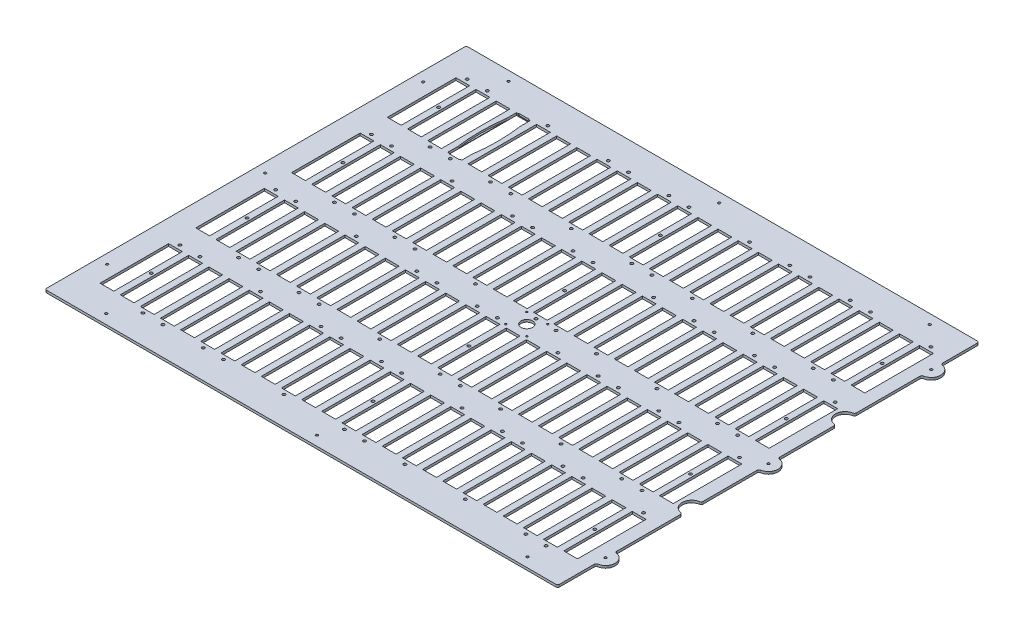
from build123d import *

# Parameters (mm, degrees)
BOSS_EXTRUDE1_DEPTH          = 3.175
SKETCH17_W                   = 18.288
SKETCH17_H                   = 90.932
CUT_EXTRUDE5_DEPTH           = 451.265762746
F_25_0_1495_DIAMETER_HOLE1_D = 3.7973
FILLET1_R                    = 2.54
F_6_CLEARANCE_HOLE1_D        = 3.7973
F_2_CLEARANCE_HOLE1_D        = 2.4384
SKETCH20_R                   = 7.62
CUT_EXTRUDE6_DEPTH           = 451.265762746
F_1_8_0_125_DIAMETER_HOLE1_D = 3.175
CUT_EXTRUDE7_DEPTH           = 2.54


with BuildPart() as part:
    # Sketch1 → Boss-Extrude1 (new body)
    with BuildSketch(Plane(origin=(0, 0, 0), x_dir=(1, 0, 0), z_dir=(0, 1, 0))):
        with BuildLine():
            Line((340.1822, 228.7524), (340.1822, 279.5524))
            Line((340.1822, 279.5524), (-340.1822, 279.5524))
            Line((-340.1822, 279.5524), (-340.1822, -279.5524))
            Line((-340.1822, -279.5524), (340.1822, -279.5524))
            Line((340.1822, -279.5524), (340.1822, -228.7524))
            ThreePointArc((340.1822, -228.7524), (352.8822, -216.0524), (340.1822, -203.3524))
            Line((340.1822, -203.3524), (340.1822, -114.4524))
            ThreePointArc((340.1822, -114.4524), (327.4822, -101.7524), (340.1822, -89.0524))
            Line((340.1822, -89.0524), (340.1822, -12.699771398))
            ThreePointArc((340.1822, -12.699771398), (352.9584, 0), (340.1822, 12.699771398))
            Line((340.1822, 12.699771398), (340.1822, 89.0524))
            ThreePointArc((340.1822, 89.0524), (327.4822, 101.7524), (340.1822, 114.4524))
            Line((340.1822, 114.4524), (340.1822, 203.3524))
            ThreePointArc((340.1822, 203.3524), (352.8822, 216.0524), (340.1822, 228.7524))
        make_face()
    extrude(amount=BOSS_EXTRUDE1_DEPTH)

    # Sketch17 → Cut-Extrude5 (cut, through all)
    with BuildSketch(Plane(origin=(0, 3.175, 0), x_dir=(1, 0, 0), z_dir=(0, 1, 0))):
        with Locations((-274.623695652, 190.6524)):
            Rectangle(SKETCH17_W, SKETCH17_H)
        with Locations((-301.371, 190.6524)):
            Rectangle(SKETCH17_W, SKETCH17_H)
        with Locations((-247.876391304, 190.6524)):
            Rectangle(SKETCH17_W, SKETCH17_H)
        with Locations((-221.129086957, 190.6524)):
            Rectangle(SKETCH17_W, SKETCH17_H)
        with Locations((-194.381782609, 190.6524)):
            Rectangle(SKETCH17_W, SKETCH17_H)
        with Locations((-167.634478261, 190.6524)):
            Rectangle(SKETCH17_W, SKETCH17_H)
        with Locations((-140.887173913, 190.6524)):
            Rectangle(SKETCH17_W, SKETCH17_H)
        with Locations((-114.139869565, 190.6524)):
            Rectangle(SKETCH17_W, SKETCH17_H)
        with Locations((-87.392565217, 190.6524)):
            Rectangle(SKETCH17_W, SKETCH17_H)
        with Locations((-60.64526087, 190.6524)):
            Rectangle(SKETCH17_W, SKETCH17_H)
        with Locations((-33.897956522, 190.6524)):
            Rectangle(SKETCH17_W, SKETCH17_H)
        with Locations((-7.150652174, 190.6524)):
            Rectangle(SKETCH17_W, SKETCH17_H)
        with Locations((19.596652174, 190.6524)):
            Rectangle(SKETCH17_W, SKETCH17_H)
        with Locations((46.343956522, 190.6524)):
            Rectangle(SKETCH17_W, SKETCH17_H)
        with Locations((73.09126087, 190.6524)):
            Rectangle(SKETCH17_W, SKETCH17_H)
        with Locations((99.838565217, 190.6524)):
            Rectangle(SKETCH17_W, SKETCH17_H)
        with Locations((126.585869565, 190.6524)):
            Rectangle(SKETCH17_W, SKETCH17_H)
        with Locations((153.333173913, 190.6524)):
            Rectangle(SKETCH17_W, SKETCH17_H)
        with Locations((180.080478261, 190.6524)):
            Rectangle(SKETCH17_W, SKETCH17_H)
        with Locations((206.827782609, 190.6524)):
            Rectangle(SKETCH17_W, SKETCH17_H)
        with Locations((233.575086957, 190.6524)):
            Rectangle(SKETCH17_W, SKETCH17_H)
        with Locations((260.322391304, 190.6524)):
            Rectangle(SKETCH17_W, SKETCH17_H)
        with Locations((287.069695652, 190.6524)):
            Rectangle(SKETCH17_W, SKETCH17_H)
        with Locations((313.817, 190.6524)):
            Rectangle(SKETCH17_W, SKETCH17_H)
        with Locations((-274.623695652, 63.5762)):
            Rectangle(SKETCH17_W, SKETCH17_H)
        with Locations((-247.876391304, 63.5762)):
            Rectangle(SKETCH17_W, SKETCH17_H)
        with Locations((-221.129086957, 63.5762)):
            Rectangle(SKETCH17_W, SKETCH17_H)
        with Locations((-194.381782609, 63.5762)):
            Rectangle(SKETCH17_W, SKETCH17_H)
        with Locations((-167.634478261, 63.5762)):
            Rectangle(SKETCH17_W, SKETCH17_H)
        with Locations((-140.887173913, 63.5762)):
            Rectangle(SKETCH17_W, SKETCH17_H)
        with Locations((-114.139869565, 63.5762)):
            Rectangle(SKETCH17_W, SKETCH17_H)
        with Locations((-87.392565217, 63.5762)):
            Rectangle(SKETCH17_W, SKETCH17_H)
        with Locations((-60.64526087, 63.5762)):
            Rectangle(SKETCH17_W, SKETCH17_H)
        with Locations((-33.897956522, 63.5762)):
            Rectangle(SKETCH17_W, SKETCH17_H)
        with Locations((-7.150652174, 63.5762)):
            Rectangle(SKETCH17_W, SKETCH17_H)
        with Locations((19.596652174, 63.5762)):
            Rectangle(SKETCH17_W, SKETCH17_H)
        with Locations((46.343956522, 63.5762)):
            Rectangle(SKETCH17_W, SKETCH17_H)
        with Locations((73.09126087, 63.5762)):
            Rectangle(SKETCH17_W, SKETCH17_H)
        with Locations((99.838565217, 63.5762)):
            Rectangle(SKETCH17_W, SKETCH17_H)
        with Locations((126.585869565, 63.5762)):
            Rectangle(SKETCH17_W, SKETCH17_H)
        with Locations((153.333173913, 63.5762)):
            Rectangle(SKETCH17_W, SKETCH17_H)
        with Locations((180.080478261, 63.5762)):
            Rectangle(SKETCH17_W, SKETCH17_H)
        with Locations((206.827782609, 63.5762)):
            Rectangle(SKETCH17_W, SKETCH17_H)
        with Locations((233.575086957, 63.5762)):
            Rectangle(SKETCH17_W, SKETCH17_H)
        with Locations((260.322391304, 63.5762)):
            Rectangle(SKETCH17_W, SKETCH17_H)
        with Locations((287.069695652, 63.5762)):
            Rectangle(SKETCH17_W, SKETCH17_H)
        with Locations((313.817, 63.5762)):
            Rectangle(SKETCH17_W, SKETCH17_H)
        with Locations((-274.623695652, -63.5)):
            Rectangle(SKETCH17_W, SKETCH17_H)
        with Locations((-247.876391304, -63.5)):
            Rectangle(SKETCH17_W, SKETCH17_H)
        with Locations((-221.129086957, -63.5)):
            Rectangle(SKETCH17_W, SKETCH17_H)
        with Locations((-194.381782609, -63.5)):
            Rectangle(SKETCH17_W, SKETCH17_H)
        with Locations((-167.634478261, -63.5)):
            Rectangle(SKETCH17_W, SKETCH17_H)
        with Locations((-140.887173913, -63.5)):
            Rectangle(SKETCH17_W, SKETCH17_H)
        with Locations((-114.139869565, -63.5)):
            Rectangle(SKETCH17_W, SKETCH17_H)
        with Locations((-87.392565217, -63.5)):
            Rectangle(SKETCH17_W, SKETCH17_H)
        with Locations((-60.64526087, -63.5)):
            Rectangle(SKETCH17_W, SKETCH17_H)
        with Locations((-33.897956522, -63.5)):
            Rectangle(SKETCH17_W, SKETCH17_H)
        with Locations((-7.150652174, -63.5)):
            Rectangle(SKETCH17_W, SKETCH17_H)
        with Locations((19.596652174, -63.5)):
            Rectangle(SKETCH17_W, SKETCH17_H)
        with Locations((46.343956522, -63.5)):
            Rectangle(SKETCH17_W, SKETCH17_H)
        with Locations((73.09126087, -63.5)):
            Rectangle(SKETCH17_W, SKETCH17_H)
        with Locations((99.838565217, -63.5)):
            Rectangle(SKETCH17_W, SKETCH17_H)
        with Locations((126.585869565, -63.5)):
            Rectangle(SKETCH17_W, SKETCH17_H)
        with Locations((153.333173913, -63.5)):
            Rectangle(SKETCH17_W, SKETCH17_H)
        with Locations((180.080478261, -63.5)):
            Rectangle(SKETCH17_W, SKETCH17_H)
        with Locations((206.827782609, -63.5)):
            Rectangle(SKETCH17_W, SKETCH17_H)
        with Locations((233.575086957, -63.5)):
            Rectangle(SKETCH17_W, SKETCH17_H)
        with Locations((260.322391304, -63.5)):
            Rectangle(SKETCH17_W, SKETCH17_H)
        with Locations((287.069695652, -63.5)):
            Rectangle(SKETCH17_W, SKETCH17_H)
        with Locations((313.817, -63.5)):
            Rectangle(SKETCH17_W, SKETCH17_H)
        with Locations((-274.623695652, -190.5762)):
            Rectangle(SKETCH17_W, SKETCH17_H)
        with Locations((-247.876391304, -190.5762)):
            Rectangle(SKETCH17_W, SKETCH17_H)
        with Locations((-221.129086957, -190.5762)):
            Rectangle(SKETCH17_W, SKETCH17_H)
        with Locations((-194.381782609, -190.5762)):
            Rectangle(SKETCH17_W, SKETCH17_H)
        with Locations((-167.634478261, -190.5762)):
            Rectangle(SKETCH17_W, SKETCH17_H)
        with Locations((-140.887173913, -190.5762)):
            Rectangle(SKETCH17_W, SKETCH17_H)
        with Locations((-114.139869565, -190.5762)):
            Rectangle(SKETCH17_W, SKETCH17_H)
        with Locations((-87.392565217, -190.5762)):
            Rectangle(SKETCH17_W, SKETCH17_H)
        with Locations((-60.64526087, -190.5762)):
            Rectangle(SKETCH17_W, SKETCH17_H)
        with Locations((-33.897956522, -190.5762)):
            Rectangle(SKETCH17_W, SKETCH17_H)
        with Locations((-7.150652174, -190.5762)):
            Rectangle(SKETCH17_W, SKETCH17_H)
        with Locations((19.596652174, -190.5762)):
            Rectangle(SKETCH17_W, SKETCH17_H)
        with Locations((46.343956522, -190.5762)):
            Rectangle(SKETCH17_W, SKETCH17_H)
        with Locations((73.09126087, -190.5762)):
            Rectangle(SKETCH17_W, SKETCH17_H)
        with Locations((99.838565217, -190.5762)):
            Rectangle(SKETCH17_W, SKETCH17_H)
        with Locations((126.585869565, -190.5762)):
            Rectangle(SKETCH17_W, SKETCH17_H)
        with Locations((153.333173913, -190.5762)):
            Rectangle(SKETCH17_W, SKETCH17_H)
        with Locations((180.080478261, -190.5762)):
            Rectangle(SKETCH17_W, SKETCH17_H)
        with Locations((206.827782609, -190.5762)):
            Rectangle(SKETCH17_W, SKETCH17_H)
        with Locations((233.575086957, -190.5762)):
            Rectangle(SKETCH17_W, SKETCH17_H)
        with Locations((260.322391304, -190.5762)):
            Rectangle(SKETCH17_W, SKETCH17_H)
        with Locations((287.069695652, -190.5762)):
            Rectangle(SKETCH17_W, SKETCH17_H)
        with Locations((313.817, -190.5762)):
            Rectangle(SKETCH17_W, SKETCH17_H)
        with Locations((-301.371, 63.5762)):
            Rectangle(SKETCH17_W, SKETCH17_H)
        with Locations((-301.371, -63.5)):
            Rectangle(SKETCH17_W, SKETCH17_H)
        with Locations((-301.371, -190.5762)):
            Rectangle(SKETCH17_W, SKETCH17_H)
    extrude(amount=-CUT_EXTRUDE5_DEPTH, mode=Mode.SUBTRACT)

    # #25 (0.1495) Diameter Hole1 (through all)
    with Locations(Plane(origin=(0, 3.175, 0), x_dir=(1, 0, 0), z_dir=(0, 1, 0))):
        with Locations((313.817, -139.2682), (-301.447239116, 241.9604), (-274.696620024, 241.9604), (-247.946000932, 139.3444), (-221.19538184, 139.3444), (-194.444762748, 241.9604), (-167.694143656, 139.3444), (-140.943524564, 139.3444), (-114.192905472, 241.9604), (-87.44228638, 241.9604), (-60.691667288, 139.3444), (-33.941048196, 241.9604), (-7.190429104, 241.9604), (19.560189988, 139.3444), (46.31080908, 139.3444), (73.061428172, 241.9604), (99.812047264, 139.3444), (126.562666356, 241.9604), (153.313285448, 241.9604), (180.06390454, 139.3444), (206.814523632, 241.9604), (233.565142724, 241.9604), (260.315761816, 139.3444), (287.066380908, 139.3444), (313.817, 241.9604), (-301.447239116, 114.8842), (-274.696620024, 114.8842), (-247.946000932, 12.2682), (-221.19538184, 12.2682), (-194.444762748, 114.8842), (-167.694143656, 12.2682), (-140.943524564, 12.2682), (-114.192905472, 114.8842), (-87.44228638, 114.8842), (-60.691667288, 12.2682), (-33.941048196, 114.8842), (-7.190429104, 114.8842), (19.560189988, 12.2682), (46.31080908, 12.2682), (73.061428172, 114.8842), (99.812047264, 12.2682), (126.562666356, 114.8842), (153.313285448, 114.8842), (180.06390454, 12.2682), (206.814523632, 114.8842), (233.565142724, 114.8842), (260.315761816, 12.2682), (287.066380908, 12.2682), (313.817, 114.8842), (-301.447239116, -12.192), (-274.696620024, -12.192), (-247.946000932, -114.808), (-221.19538184, -114.808), (-194.444762748, -12.192), (-167.694143656, -114.808), (-140.943524564, -114.808), (-114.192905472, -12.192), (-87.44228638, -12.192), (-60.691667288, -114.808), (-33.941048196, -12.192), (-7.190429104, -12.192), (19.560189988, -114.808), (46.31080908, -114.808), (73.061428172, -12.192), (99.812047264, -114.808), (126.562666356, -12.192), (153.313285448, -12.192), (180.06390454, -114.808), (206.814523632, -12.192), (233.565142724, -12.192), (260.315761816, -114.808), (287.066380908, -114.808), (313.817, -12.192), (-301.447239116, -139.2682), (-274.696620024, -139.2682), (-247.946000932, -241.8842), (-221.19538184, -241.8842), (-194.444762748, -139.2682), (-167.694143656, -241.8842), (-140.943524564, -241.8842), (-114.192905472, -139.2682), (-87.44228638, -139.2682), (-60.691667288, -241.8842), (-33.941048196, -139.2682), (-7.190429104, -139.2682), (19.560189988, -241.8842), (46.31080908, -241.8842), (73.061428172, -139.2682), (99.812047264, -241.8842), (126.562666356, -139.2682), (153.313285448, -139.2682), (180.06390454, -241.8842), (206.814523632, -139.2682), (233.565142724, -139.2682), (260.315761816, -241.8842), (287.066380908, -241.8842)):
            Hole(F_25_0_1495_DIAMETER_HOLE1_D / 2)

    # Fillet1
    fillet1_edges = [part.edges().sort_by_distance(p)[0] for p in [
        (-340.1822, 1.5875, -279.5524),
        (-340.1822, 1.5875, 279.5524),
        (340.1822, 1.5875, -279.5524),
        (340.1822, 1.5875, -228.7524),
        (340.1822, 1.5875, 279.5524),
        (340.1822, 1.5875, 228.7524),
        (340.1822, 1.5875, 203.3524),
        (340.1822, 1.5875, 114.4524),
        (340.1822, 1.5875, 89.0524),
        (340.1822, 1.5875, 12.699771398),
        (340.1822, 1.5875, -12.699771398),
        (340.1822, 1.5875, -89.0524),
        (340.1822, 1.5875, -114.4524),
        (340.1822, 1.5875, -203.3524),
    ]]
    fillet(fillet1_edges, radius=FILLET1_R)

    # #6 Clearance Hole1 (through all)
    with Locations(Plane(origin=(0, 3.175, 0), x_dir=(1, 0, 0), z_dir=(0, 1, 0))):
        with Locations((300.443347826, -190.5762), (-287.997347826, 190.6524), (6.223, 190.6524), (300.443347826, 190.6524), (-287.997347826, 63.5762), (6.223, 63.5762), (300.443347826, 63.5762), (-287.997347826, -63.5), (6.223, -63.5), (300.443347826, -63.5), (-287.997347826, -190.5762), (6.223, -190.5762)):
            Hole(F_6_CLEARANCE_HOLE1_D / 2)

    # #2 Clearance Hole1 (through all)
    with Locations(Plane(origin=(0, 3.175, 0), x_dir=(1, 0, 0), z_dir=(0, 1, 0))):
        with Locations((33.5661, 14.0081), (5.6261, 14.0081), (5.6261, -13.9319), (33.5661, -13.9319)):
            Hole(F_2_CLEARANCE_HOLE1_D / 2)

    # Sketch20 → Cut-Extrude6 (cut, through all)
    with BuildSketch(Plane(origin=(0, 3.175, 0), x_dir=(1, 0, 0), z_dir=(0, 1, 0))):
        with Locations((19.5961, 0.0381)):
            Circle(SKETCH20_R)
    extrude(amount=-CUT_EXTRUDE6_DEPTH, mode=Mode.SUBTRACT)

    # 1/8 (0.125) Diameter Hole1 (through all)
    with Locations(Plane(origin=(0, 3.175, 0), x_dir=(1, 0, 0), z_dir=(0, 1, 0))):
        with Locations((287.3502, 266.8524), (287.3502, -266.8524), (7.9502, -266.8524), (-271.4498, -266.8524), (-327.4822, -209.55), (-327.4822, 0), (-327.4822, 209.55), (-271.4498, 266.8524), (7.9502, 266.8524), (340.1822, 216.0524), (340.2584, 0), (340.1822, -216.0524)):
            Hole(F_1_8_0_125_DIAMETER_HOLE1_D / 2)

    # Sketch23 → Cut-Extrude7 (cut)
    with BuildSketch(Plane(origin=(0, 3.175, 0), x_dir=(1, 0, 0), z_dir=(0, 1, 0))):
        with BuildLine():
            Line((-227.860086957, 237.0074), (-214.398086957, 237.0074))
            add(Edge.make_bspline(
                [(-214.398086957, 237.0074), (-205.000086957, 190.6524), (-214.398086957, 144.2974)],
                knots=[0, 0, 0, 1, 1, 1], degree=2))
            Line((-214.398086957, 144.2974), (-227.860086957, 144.2974))
            add(Edge.make_bspline(
                [(-227.860086957, 237.0074), (-237.258086957, 190.6524), (-227.860086957, 144.2974)],
                knots=[0, 0, 0, 1, 1, 1], degree=2))
        make_face()
    extrude(amount=-CUT_EXTRUDE7_DEPTH, mode=Mode.SUBTRACT)


solid = part.part
